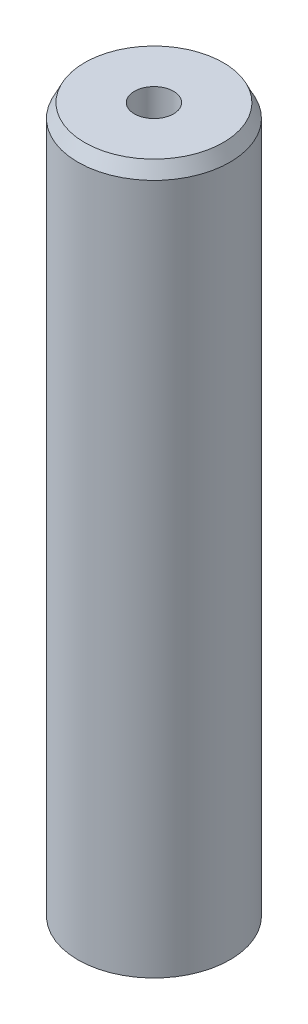
from build123d import *
from OCP.BRepFilletAPI import BRepFilletAPI_MakeChamfer

# Parameters (mm, degrees)
SKETCH1_R           = 10
BOSS_EXTRUDE1_DEPTH = 93.518867958
SKETCH2_R           = 2.577456827
CUT_EXTRUDE1_DEPTH  = 95.582126557
CHAMFER1_SIZE       = 1.795217101
CHAMFER1_SIZE2      = 0.88726256


with BuildPart() as part:
    # Sketch1 → Boss-Extrude1 (new body)
    with BuildSketch(Plane(origin=(0, 0, 0), x_dir=(1, 0, 0), z_dir=(0, 1, 0))):
        Circle(SKETCH1_R)
    extrude(amount=BOSS_EXTRUDE1_DEPTH)

    # Sketch2 → Cut-Extrude1 (cut, through all)
    with BuildSketch(Plane(origin=(0, 0, 0), x_dir=(1, 0, 0), z_dir=(0, 1, 0))):
        Circle(SKETCH2_R)
    extrude(amount=CUT_EXTRUDE1_DEPTH, mode=Mode.SUBTRACT)

    # Chamfer1: one chamfer whose edges measure the first distance from different faces: ONE call of the kernel's chamfer builder (chamfer() names one face for all edges)
    chamfer1_edges_1 = [part.edges().sort_by_distance(p)[0] for p in [
        (-10, 93.518867958, 0),
    ]]
    chamfer1_side_1 = [part.faces().sort_by_distance(p)[0] for p in [
        (-10, 46.759433979, 0),
    ]]
    chamfer1_edges_2 = [part.edges().sort_by_distance(p)[0] for p in [
        (-10, 0, 0),
    ]]
    chamfer1_side_2 = [part.faces().sort_by_distance(p)[0] for p in [
        (-9.717157288, 0, 0),
    ]]
    chamfer1 = BRepFilletAPI_MakeChamfer(part.part.solid().wrapped)
    for e in chamfer1_edges_1:
        chamfer1.Add(CHAMFER1_SIZE, CHAMFER1_SIZE2, e.wrapped, chamfer1_side_1[0].wrapped)  # the first distance lies on this face
    for e in chamfer1_edges_2:
        chamfer1.Add(CHAMFER1_SIZE, CHAMFER1_SIZE2, e.wrapped, chamfer1_side_2[0].wrapped)  # the first distance lies on this face
    add(Compound.cast(chamfer1.Shape()), mode=Mode.REPLACE)


solid = part.part
